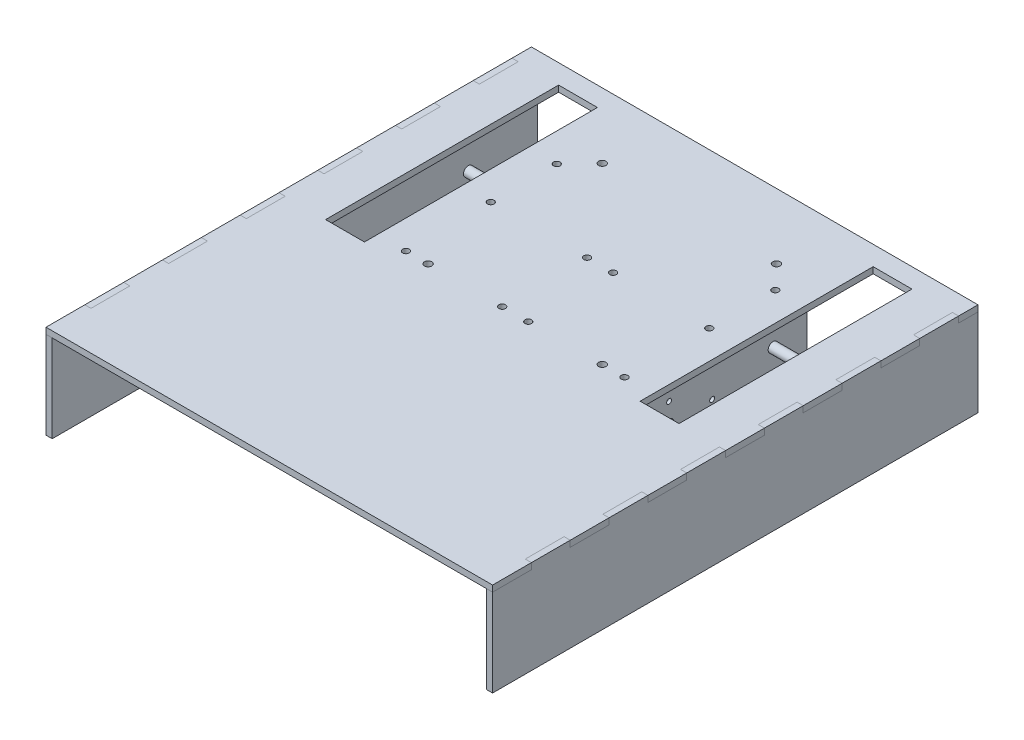
from build123d import *

# Parameters (mm, degrees)
SKETCH2_W           = 20
SKETCH2_H           = 120
BOSS_EXTRUDE1_DEPTH = 3.175
BOSS_EXTRUDE2_DEPTH = 3.175
BOSS_EXTRUDE3_DEPTH = 1.6129
SKETCH6_R           = 2.55
SKETCH6_R_2         = 1.27
SKETCH6_R_3         = 2.3749
BOSS_EXTRUDE4_DEPTH = 1.6129
SKETCH7_R           = 1.7
SKETCH7_R_2         = 1.9
CUT_EXTRUDE1_DEPTH  = 10
SKETCH9_R           = 2.5
BOSS_EXTRUDE6_DEPTH = 189


with BuildPart() as part:
    # Sketch2 → Boss-Extrude1 (new body)
    with BuildSketch(Plane(origin=(0, 0, 0), x_dir=(1, 0, 0), z_dir=(0, 1, 0))):
        Polygon((-172.266187111, -88.214102909), (57.733812889, -88.214102909), (57.733812889, -68.214102909), (54.558812889, -68.214102909), (54.558812889, -48.214102909), (57.733812889, -48.214102909), (57.733812889, -28.214102909), (54.558812889, -28.214102909), (54.558812889, -8.214102909), (57.733812889, -8.214102909), (57.733812889, 11.785897091), (54.558812889, 11.785897091), (54.558812889, 31.785897091), (57.733812889, 31.785897091), (57.733812889, 51.785897091), (54.558812889, 51.785897091), (54.558812889, 71.785897091), (57.733812889, 71.785897091), (57.733812889, 91.785897091), (54.558812889, 91.785897091), (54.558812889, 111.785897091), (57.733812889, 111.785897091), (57.733812889, 131.785897091), (54.558812889, 131.785897091), (54.558812889, 151.785897091), (57.733812889, 151.785897091), (57.733812889, 161.785897091), (-172.266187111, 161.785897091), (-172.266187111, 151.785897091), (-169.091187111, 151.785897091), (-169.091187111, 131.785897091), (-172.266187111, 131.785897091), (-172.266187111, 111.785897091), (-169.091187111, 111.785897091), (-169.091187111, 91.785897091), (-172.266187111, 91.785897091), (-172.266187111, 71.785897091), (-169.091187111, 71.785897091), (-169.091187111, 51.785897091), (-172.266187111, 51.785897091), (-172.266187111, 31.785897091), (-169.091187111, 31.785897091), (-169.091187111, 11.785897091), (-172.266187111, 11.785897091), (-172.266187111, -8.214102909), (-169.091187111, -8.214102909), (-169.091187111, -28.214102909), (-172.266187111, -28.214102909), (-172.266187111, -48.214102909), (-169.091187111, -48.214102909), (-169.091187111, -68.214102909), (-172.266187111, -68.214102909), align=None)
        with Locations((23.733812889, 91.785897091)):
            Rectangle(SKETCH2_W, SKETCH2_H, mode=Mode.SUBTRACT)
        with Locations((-138.266187111, 91.785897091)):
            Rectangle(SKETCH2_W, SKETCH2_H, mode=Mode.SUBTRACT)
    extrude(amount=BOSS_EXTRUDE1_DEPTH)


with BuildPart() as body_2:
    # Sketch3 → Boss-Extrude2 (new body)
    with BuildSketch(Plane.ZY.offset(169.091187111)):
        Polygon((68.214102909, 3.175), (68.214102909, 0), (88.214102909, 0), (88.214102909, -45), (-161.732040232, -45), (-161.732040232, 0), (-151.785897091, 0), (-151.785897091, 3.175), (-131.785897091, 3.175), (-131.785897091, 0), (-111.785897091, 0), (-111.785897091, 3.175), (-91.785897091, 3.175), (-91.785897091, 0), (-71.785897091, 0), (-71.785897091, 3.175), (-51.785897091, 3.175), (-51.785897091, 0), (-31.785897091, 0), (-31.785897091, 3.175), (-11.785897091, 3.175), (-11.785897091, 0), (8.214102909, 0), (8.214102909, 3.175), (28.214102909, 3.175), (28.214102909, 0), (48.214102909, 0), (48.214102909, 3.175), align=None)
    extrude(amount=BOSS_EXTRUDE2_DEPTH)


with BuildPart() as body_3:
    # Sketch4 → Boss-Extrude3 (new body)
    with BuildSketch(Plane.XZ):
        Polygon((-123.266187111, -122.812619878), (-123.266187111, -33.608114229), (-108.850667454, -33.608114229), (-105.428738975, -55.404375385), (-68.179527552, -55.404375385), (-68.179527552, -32.986733746), (-59.765041143, -32.986733746), (-59.765041143, -87.177277304), (-68.179527552, -87.177277304), (-68.179527552, -65.404375385), (-105.42560363, -65.404375385), (-105.42560363, -122.812619878), align=None)
    extrude(amount=BOSS_EXTRUDE3_DEPTH)

    # Sketch6 → Boss-Extrude4 (add)
    with BuildSketch(Plane(origin=(-123.266187111, 113.834921078, 0), x_dir=(0, -1, 0), z_dir=(1, 0, 0))):
        with BuildLine():
            Line((135.739549122, 122.812619878), (113.834921078, 122.812619878))
            Line((113.834921078, 122.812619878), (113.834921078, 33.608114229))
            Line((113.834921078, 33.608114229), (133.404101078, 33.608114229))
            ThreePointArc((133.404101078, 33.608114229), (160.174858131, 59.23553889), (135.739549122, 87.098668677))
            Line((135.739549122, 87.098668677), (135.739549122, 122.812619878))
        make_face()
        with Locations((125.834921078, 105.254818177)):
            Circle(SKETCH6_R, mode=Mode.SUBTRACT)
        with Locations((143.614901078, 51.685825385)):
            Circle(SKETCH6_R_2, mode=Mode.SUBTRACT)
        with Locations((123.193301078, 51.685825385)):
            Circle(SKETCH6_R_2, mode=Mode.SUBTRACT)
        with Locations((133.404101078, 51.685825385)):
            Circle(SKETCH6_R_3, mode=Mode.SUBTRACT)
        with Locations((133.404101078, 73.860025385)):
            Circle(SKETCH6_R_2, mode=Mode.SUBTRACT)
    extrude(amount=BOSS_EXTRUDE4_DEPTH)


with BuildPart() as cut_extrude1_tool:
    # Sketch7 → Cut-Extrude1 (new body)
    with BuildSketch(Plane.XZ.offset(1.6129)):
        with Locations((-113.53944537, -82.124992621)):
            Circle(SKETCH7_R)
        with Locations((-113.53944537, -38.429929163)):
            Circle(SKETCH7_R)
        with Locations((-63.972284348, -38.429929163)):
            Circle(SKETCH7_R)
        with Locations((-63.972284348, -82.124992621)):
            Circle(SKETCH7_R)
        with Locations((-113.53944537, -116.120284507)):
            Circle(SKETCH7_R)
        with Locations((-102.118387528, -38.429929163)):
            Circle(SKETCH7_R_2)
        with Locations((-102.118387528, -128.129929163)):
            Circle(SKETCH7_R_2)
    cut_extrude1 = extrude(amount=-CUT_EXTRUDE1_DEPTH)


with BuildPart() as part_1:
    add(part.part)

    # Cut-Extrude1: cut by cut_extrude1_tool
    add(cut_extrude1_tool.part, mode=Mode.SUBTRACT)

    # Mirror2: Cut-Extrude1 across plane
    add(cut_extrude1.mirror(Plane.ZY.offset(57.266187111)), mode=Mode.SUBTRACT)


with BuildPart() as body_3_1:
    add(body_3.part)

    # Cut-Extrude1: cut by cut_extrude1_tool
    add(cut_extrude1_tool.part, mode=Mode.SUBTRACT)


with BuildPart() as body_4:
    # Mirror1: mirrored copy
    add(body_3_1.part.mirror(Plane.ZY.offset(57.266187111)))


with BuildPart() as body_5:
    # Mirror1 2: mirrored copy
    add(body_2.part.mirror(Plane.ZY.offset(57.266187111)))


with BuildPart() as body_6:
    # Sketch9 → Boss-Extrude6 (new body)
    with BuildSketch(Plane(origin=(-148.266187111, 0, 0), x_dir=(0, 0, -1), z_dir=(1, 0, 0))):
        with Locations((105.254818177, -12)):
            Circle(SKETCH9_R)
    extrude(amount=BOSS_EXTRUDE6_DEPTH)


solid = Compound([body_2.part, part_1.part, body_3_1.part, body_4.part, body_5.part, body_6.part])
